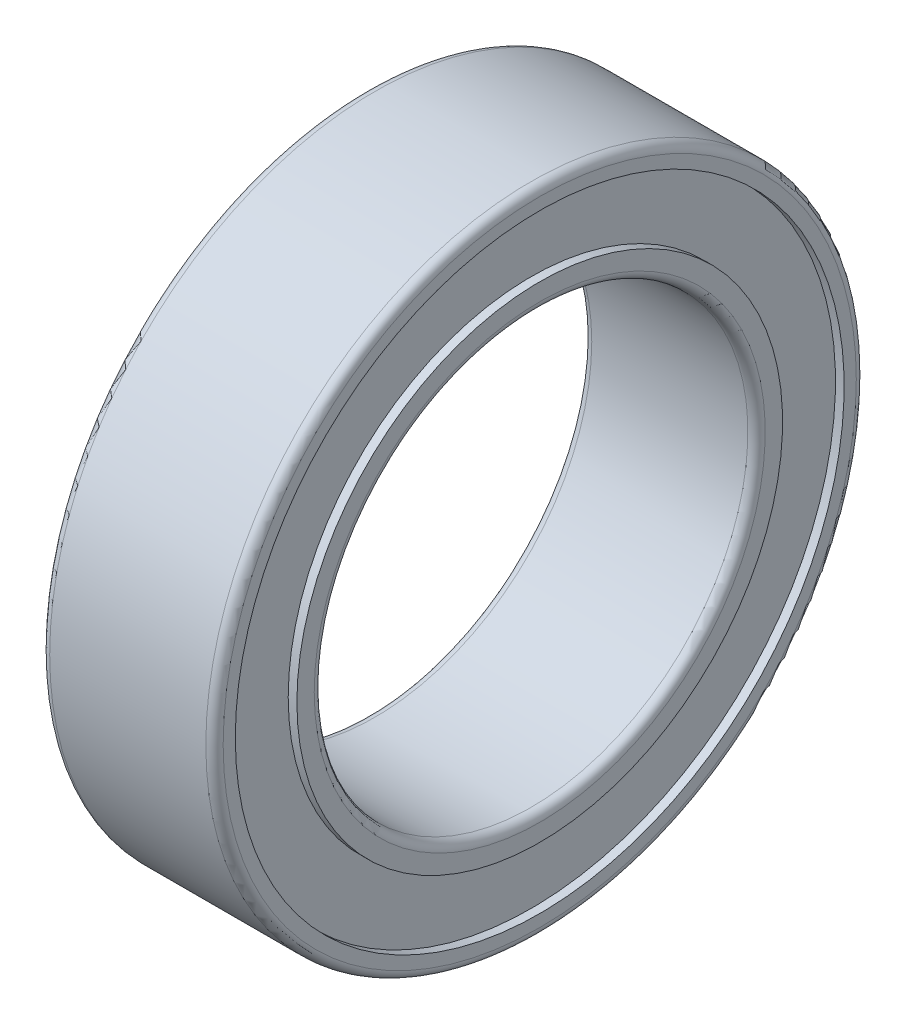
from build123d import *

# Parameters (mm, degrees)
FILLET1_R = 0.2
FILLET2_R = 0.2


with BuildPart() as part:
    # Sketch1 → Revolve1 (revolve)
    with BuildSketch(Plane.XY):
        Polygon((0, 5), (4, 5), (4, 5.6), (3.8, 5.6), (3.8, 7.02), (4, 7.02), (4, 7.5), (0, 7.5), (0, 7.02), (0.2, 7.02), (0.2, 5.6), (0, 5.6), align=None)
    revolve(axis=Axis((0, 0, 0), (1, 0, 0)))

    # Fillet1
    fillet1_edges = [part.edges().sort_by_distance(p)[0] for p in [
        (4, -7.5, 0),
        (0, -7.5, 0),
    ]]
    fillet(fillet1_edges, radius=FILLET1_R)

    # Fillet2
    fillet2_edges = [part.edges().sort_by_distance(p)[0] for p in [
        (4, -5, 0),
        (0, -5, 0),
    ]]
    fillet(fillet2_edges, radius=FILLET2_R)


solid = part.part
